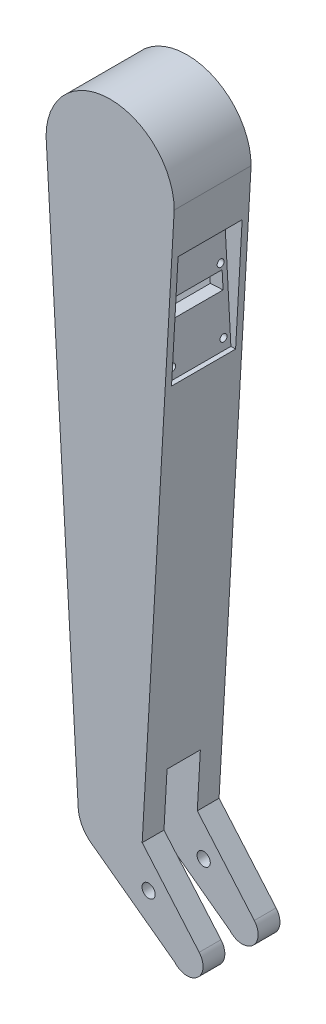
from build123d import *

# Parameters (mm, degrees)
ESQUISSE1_R                  = 2.575
BOSS_EXTRU_1_DEPTH           = 30
ENL_V_MAT_EXTRU_1_DEPTH      = 154.633085629
ENL_V_MAT_EXTRU_1_DEPTH_BACK = 154.633085629
ESQUISSE2_W                  = 25
ESQUISSE2_H                  = 45
ESQUISSE2_W_2                = 13
ESQUISSE2_H_2                = 80
ESQUISSE3_W                  = 30
ESQUISSE3_H                  = 80
ESQUISSE3_R                  = 1.35
ESQUISSE3_W_2                = 21.500268749
ESQUISSE3_H_2                = 6.675
BOSS_EXTRU_2_DEPTH           = 5
CHANFREIN1_SIZE              = 20
CHANFREIN1_SIZE2             = 21.239019518


with BuildPart() as part:
    # Esquisse1 → Boss.-Extru.1 (new body)
    with BuildSketch(Plane.XY):
        with BuildLine():
            ThreePointArc((25, 110), (0, 135), (-25, 110))
            Line((-25, 110), (-12.5, -110))
            ThreePointArc((-12.5, -110), (-11.152775163, -115.644962902), (-7.401503013, -120.073120328))
            Line((-7.401503013, -120.073120328), (25.25622395, -144.069286029))
            ThreePointArc((25.25622395, -144.069286029), (34.069286029, -144.74377605), (34.74377605, -135.930713971))
            Line((34.74377605, -135.930713971), (12.5, -110))
            Line((12.5, -110), (25, 110))
        make_face()
        with Locations((15, -125)):
            Circle(ESQUISSE1_R, mode=Mode.SUBTRACT)
    extrude(amount=BOSS_EXTRU_1_DEPTH)

    # Esquisse2 → Enlèv. mat.-Extru.1 (cut, two sides: drawn at the far end of the back side and taken through both)
    with BuildSketch(Plane(origin=(0, 0, 0), x_dir=(0, 0, -1), z_dir=(1, 0, 0)).offset(-ENL_V_MAT_EXTRU_1_DEPTH_BACK)):
        with Locations((-15, 70)):
            Rectangle(ESQUISSE2_W, ESQUISSE2_H)
        with Locations((-15, -150)):
            Rectangle(ESQUISSE2_W_2, ESQUISSE2_H_2)
    extrude(amount=ENL_V_MAT_EXTRU_1_DEPTH + ENL_V_MAT_EXTRU_1_DEPTH_BACK, mode=Mode.SUBTRACT)

    # Esquisse3 → Boss.-Extru.2 (add)
    with BuildSketch(Plane(origin=(17.252366765, 0.980248112, 0), x_dir=(0, 0, 1), z_dir=(-0.9983897448572465, -0.056726690048707416, 0))):
        with Locations((15, 71.241039186)):
            Rectangle(ESQUISSE3_W, ESQUISSE3_H)
        with Locations((5.138296092, 50.401599556)):
            Circle(ESQUISSE3_R, mode=Mode.SUBTRACT)
        with Locations((25.138296092, 50.401599556)):
            Circle(ESQUISSE3_R, mode=Mode.SUBTRACT)
        with Locations((15.188430467, 69.164099556)):
            Rectangle(ESQUISSE3_W_2, ESQUISSE3_H_2, mode=Mode.SUBTRACT)
        with Locations((4.888296092, 74.851599556)):
            Circle(ESQUISSE3_R, mode=Mode.SUBTRACT)
        with Locations((25.388296092, 74.851599556)):
            Circle(ESQUISSE3_R, mode=Mode.SUBTRACT)
    extrude(amount=-BOSS_EXTRU_2_DEPTH)

    # Chanfrein1
    chanfrein1_edges = [part.edges().sort_by_distance(p)[0] for p in [
        (12.5, -110, 15),
    ]]
    chanfrein1_side = [part.faces().sort_by_distance(p)[0] for p in [
        (0, -110, 15),
    ]]
    chamfer(chanfrein1_edges, length=CHANFREIN1_SIZE, length2=CHANFREIN1_SIZE2, reference=chanfrein1_side[0])


solid = part.part
